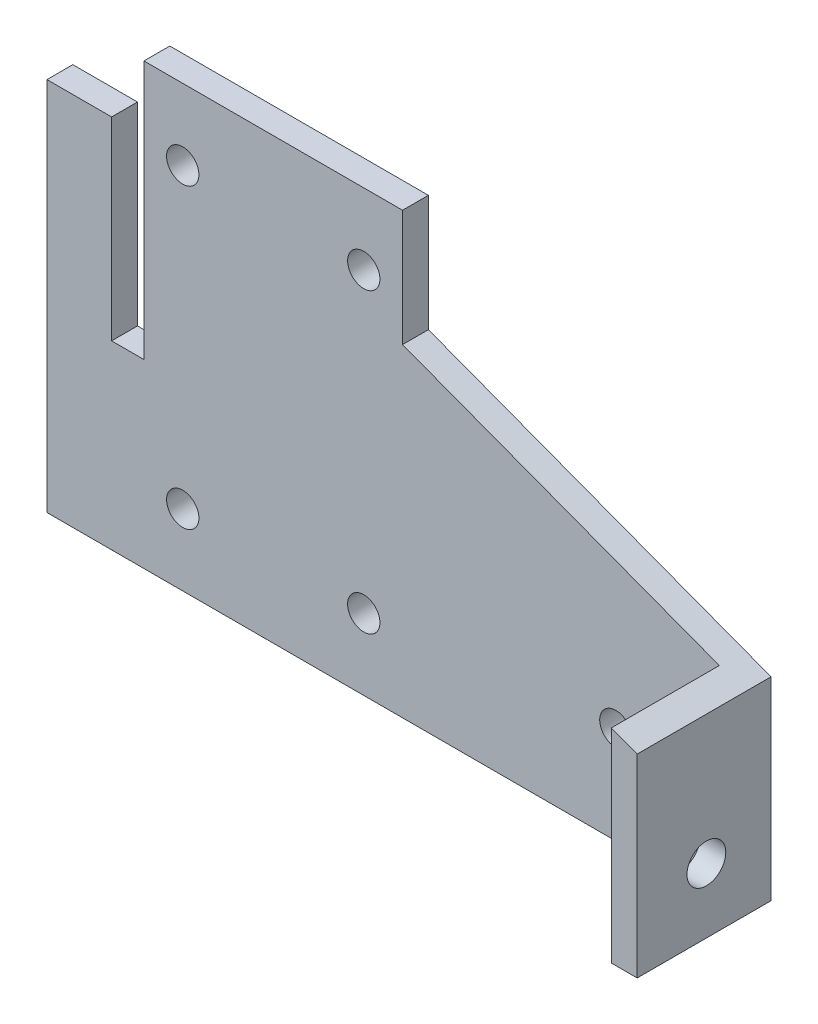
from build123d import *

# Parameters (mm, degrees)
SKETCH_1_R          = 2.5
EXTRUDE_1_DEPTH     = 4
EXTRUDE_2_DEPTH     = 16.7
SKETCH_3_R          = 3
CUT_EXTRUDE_1_DEPTH = 10
CUT_EXTRUDE_2_DEPTH = 10


with BuildPart() as part:
    # Эскиз1 → Бобышка-Вытянуть1 (new body)
    with BuildSketch(Plane.XY):
        Polygon((0, 0), (108, 0), (108, 30), (55, 50), (55, 68), (0, 68), align=None)
        with Locations((21, 57)):
            Circle(SKETCH_1_R, mode=Mode.SUBTRACT)
        with Locations((49, 57)):
            Circle(SKETCH_1_R, mode=Mode.SUBTRACT)
        with Locations((21, 11)):
            Circle(SKETCH_1_R, mode=Mode.SUBTRACT)
        with Locations((49, 11)):
            Circle(SKETCH_1_R, mode=Mode.SUBTRACT)
        with Locations((88, 15)):
            Circle(SKETCH_1_R, mode=Mode.SUBTRACT)
    extrude(amount=EXTRUDE_1_DEPTH)

    # Эскиз2 → Бобышка-Вытянуть2 (add)
    with BuildSketch(Plane.XY.offset(4)):
        Polygon((108, 0), (104, 0), (104, 31.509433962), (108, 30), align=None)
    extrude(amount=EXTRUDE_2_DEPTH)

    # Эскиз3 → Вырез-Вытянуть1 (cut)
    with BuildSketch(Plane(origin=(108, 0, 0), x_dir=(0, 0, -1), z_dir=(1, 0, 0))):
        with Locations((-10, 10)):
            Circle(SKETCH_3_R)
    extrude(amount=-CUT_EXTRUDE_1_DEPTH, mode=Mode.SUBTRACT)

    # Эскиз4 → Вырез-Вытянуть2 (cut)
    with BuildSketch(Plane.XY.offset(4)):
        Polygon((0, 68), (15, 68), (15, 58), (15, 28), (10, 28), (10, 58), (0, 58), align=None)
    extrude(amount=-CUT_EXTRUDE_2_DEPTH, mode=Mode.SUBTRACT)


solid = part.part
